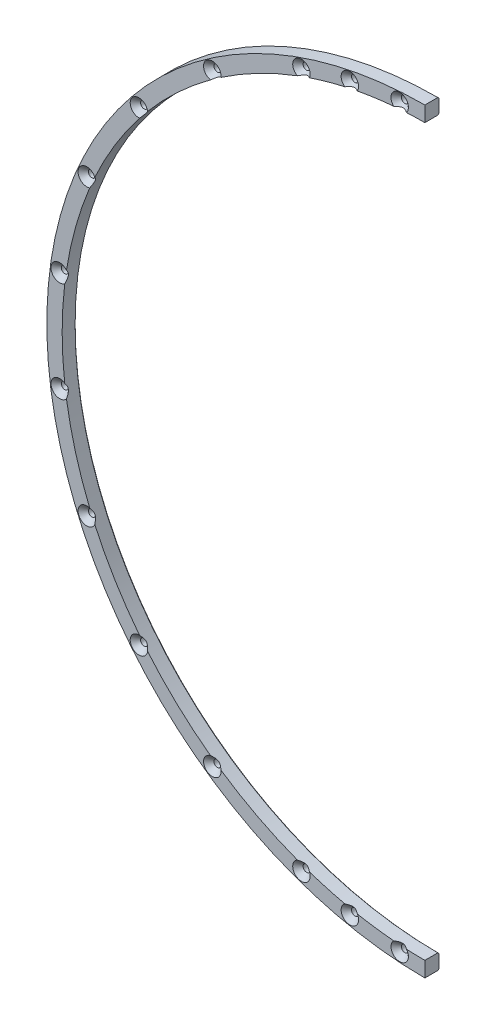
from build123d import *

# Parameters (mm, degrees)
SKETCH1_R           = 1.5
BOSS_EXTRUDE1_DEPTH = 6
CHAMFER2_SIZE       = 0.500000016


with BuildPart() as part:
    # Sketch1 → Boss-Extrude1 (new body)
    with BuildSketch(Plane.XY):
        with BuildLine():
            Line((0, -153.9), (0, -160.4))
            ThreePointArc((0, -160.4), (-160.4, 0), (0, 160.4))
            Line((0, 160.4), (0, 153.9))
            ThreePointArc((0, 153.9), (-153.9, 0), (0, -153.9))
        make_face()
        with Locations((-10.67311345, 156.035395501)):
            Circle(SKETCH1_R, mode=Mode.SUBTRACT)
        with Locations((-31.820520441, 153.128751314)):
            Circle(SKETCH1_R, mode=Mode.SUBTRACT)
        with Locations((-52.375171344, 147.369608219)):
            Circle(SKETCH1_R, mode=Mode.SUBTRACT)
        with Locations((-154.94328196, 21.296463919)):
            Circle(SKETCH1_R, mode=Mode.SUBTRACT)
        with Locations((-143.451847555, 62.309930452)):
            Circle(SKETCH1_R, mode=Mode.SUBTRACT)
        with Locations((-121.321245866, 98.702154493)):
            Circle(SKETCH1_R, mode=Mode.SUBTRACT)
        with Locations((-90.192802379, 127.774091267)):
            Circle(SKETCH1_R, mode=Mode.SUBTRACT)
        with Locations((-154.94328196, -21.296463919)):
            Circle(SKETCH1_R, mode=Mode.SUBTRACT)
        with Locations((-143.451847555, -62.309930452)):
            Circle(SKETCH1_R, mode=Mode.SUBTRACT)
        with Locations((-121.321245866, -98.702154493)):
            Circle(SKETCH1_R, mode=Mode.SUBTRACT)
        with Locations((-90.192802379, -127.774091267)):
            Circle(SKETCH1_R, mode=Mode.SUBTRACT)
        with Locations((-52.375171344, -147.369608219)):
            Circle(SKETCH1_R, mode=Mode.SUBTRACT)
        with Locations((-10.67311345, -156.035395501)):
            Circle(SKETCH1_R, mode=Mode.SUBTRACT)
        with Locations((-31.820520441, -153.128751314)):
            Circle(SKETCH1_R, mode=Mode.SUBTRACT)
    extrude(amount=BOSS_EXTRUDE1_DEPTH)

    # Chamfer1: read off the stored shape, not the designer's step
    # Chamfer1: loft between two sections, ruled curve by curve
    chamfer1_from = [
        Edge.make_three_point_arc((-9.17311345, -156.035395501, 3.8), (-10.67311345, -154.535395501, 3.8), (-12.17311345, -156.035395501, 3.8)),
        Edge.make_three_point_arc((-12.17311345, -156.035395501, 3.8), (-10.67311345, -157.535395501, 3.8), (-9.17311345, -156.035395501, 3.8)),
    ]
    chamfer1_to = [
        Edge.make_three_point_arc((-6.97311345, -156.035395501, 6), (-10.67311345, -152.335395501, 6), (-14.37311345, -156.035395501, 6)),
        Edge.make_three_point_arc((-14.37311345, -156.035395501, 6), (-10.67311345, -159.735395501, 6), (-6.97311345, -156.035395501, 6)),
    ]
    chamfer1 = Solid(Shell([*[Face.make_surface_from_curves(chamfer1_from[k], chamfer1_to[k]) for k in range(2)], Face(Wire(chamfer1_from)), Face(Wire(chamfer1_to))]))
    add(chamfer1, mode=Mode.SUBTRACT)

    # Chamfer1 2: loft between two sections, ruled curve by curve
    chamfer1_2_from = [
        Edge.make_three_point_arc((-30.320520441, -153.128751314, 3.8), (-31.820520441, -151.628751314, 3.8), (-33.320520441, -153.128751314, 3.8)),
        Edge.make_three_point_arc((-33.320520441, -153.128751314, 3.8), (-31.820520441, -154.628751314, 3.8), (-30.320520441, -153.128751314, 3.8)),
    ]
    chamfer1_2_to = [
        Edge.make_three_point_arc((-28.120520441, -153.128751314, 6), (-31.820520441, -149.428751314, 6), (-35.520520441, -153.128751314, 6)),
        Edge.make_three_point_arc((-35.520520441, -153.128751314, 6), (-31.820520441, -156.828751314, 6), (-28.120520441, -153.128751314, 6)),
    ]
    chamfer1_2 = Solid(Shell([*[Face.make_surface_from_curves(chamfer1_2_from[k], chamfer1_2_to[k]) for k in range(2)], Face(Wire(chamfer1_2_from)), Face(Wire(chamfer1_2_to))]))
    add(chamfer1_2, mode=Mode.SUBTRACT)

    # Chamfer1 3: loft between two sections, ruled curve by curve
    chamfer1_3_from = [
        Edge.make_three_point_arc((-50.875171344, -147.369608219, 3.8), (-52.375171344, -145.869608219, 3.8), (-53.875171344, -147.369608219, 3.8)),
        Edge.make_three_point_arc((-53.875171344, -147.369608219, 3.8), (-52.375171344, -148.869608219, 3.8), (-50.875171344, -147.369608219, 3.8)),
    ]
    chamfer1_3_to = [
        Edge.make_three_point_arc((-48.675171344, -147.369608219, 6), (-52.375171344, -143.669608219, 6), (-56.075171344, -147.369608219, 6)),
        Edge.make_three_point_arc((-56.075171344, -147.369608219, 6), (-52.375171344, -151.069608219, 6), (-48.675171344, -147.369608219, 6)),
    ]
    chamfer1_3 = Solid(Shell([*[Face.make_surface_from_curves(chamfer1_3_from[k], chamfer1_3_to[k]) for k in range(2)], Face(Wire(chamfer1_3_from)), Face(Wire(chamfer1_3_to))]))
    add(chamfer1_3, mode=Mode.SUBTRACT)

    # Chamfer1 4: loft between two sections, ruled curve by curve
    chamfer1_4_from = [
        Edge.make_three_point_arc((-88.692802379, -127.774091267, 3.8), (-90.192802379, -126.274091267, 3.8), (-91.692802379, -127.774091267, 3.8)),
        Edge.make_three_point_arc((-91.692802379, -127.774091267, 3.8), (-90.192802379, -129.274091267, 3.8), (-88.692802379, -127.774091267, 3.8)),
    ]
    chamfer1_4_to = [
        Edge.make_three_point_arc((-86.492802379, -127.774091267, 6), (-90.192802379, -124.074091267, 6), (-93.892802379, -127.774091267, 6)),
        Edge.make_three_point_arc((-93.892802379, -127.774091267, 6), (-90.192802379, -131.474091267, 6), (-86.492802379, -127.774091267, 6)),
    ]
    chamfer1_4 = Solid(Shell([*[Face.make_surface_from_curves(chamfer1_4_from[k], chamfer1_4_to[k]) for k in range(2)], Face(Wire(chamfer1_4_from)), Face(Wire(chamfer1_4_to))]))
    add(chamfer1_4, mode=Mode.SUBTRACT)

    # Chamfer1 5: loft between two sections, ruled curve by curve
    chamfer1_5_from = [
        Edge.make_three_point_arc((-119.821245866, -98.702154493, 3.8), (-121.321245866, -97.202154493, 3.8), (-122.821245866, -98.702154493, 3.8)),
        Edge.make_three_point_arc((-122.821245866, -98.702154493, 3.8), (-121.321245866, -100.202154493, 3.8), (-119.821245866, -98.702154493, 3.8)),
    ]
    chamfer1_5_to = [
        Edge.make_three_point_arc((-117.621245866, -98.702154493, 6), (-121.321245866, -95.002154493, 6), (-125.021245866, -98.702154493, 6)),
        Edge.make_three_point_arc((-125.021245866, -98.702154493, 6), (-121.321245866, -102.402154493, 6), (-117.621245866, -98.702154493, 6)),
    ]
    chamfer1_5 = Solid(Shell([*[Face.make_surface_from_curves(chamfer1_5_from[k], chamfer1_5_to[k]) for k in range(2)], Face(Wire(chamfer1_5_from)), Face(Wire(chamfer1_5_to))]))
    add(chamfer1_5, mode=Mode.SUBTRACT)

    # Chamfer1 6: loft between two sections, ruled curve by curve
    chamfer1_6_from = [
        Edge.make_three_point_arc((-141.951847555, -62.309930452, 3.8), (-143.451847555, -60.809930452, 3.8), (-144.951847555, -62.309930452, 3.8)),
        Edge.make_three_point_arc((-144.951847555, -62.309930452, 3.8), (-143.451847555, -63.809930452, 3.8), (-141.951847555, -62.309930452, 3.8)),
    ]
    chamfer1_6_to = [
        Edge.make_three_point_arc((-139.751847555, -62.309930452, 6), (-143.451847555, -58.609930452, 6), (-147.151847555, -62.309930452, 6)),
        Edge.make_three_point_arc((-147.151847555, -62.309930452, 6), (-143.451847555, -66.009930452, 6), (-139.751847555, -62.309930452, 6)),
    ]
    chamfer1_6 = Solid(Shell([*[Face.make_surface_from_curves(chamfer1_6_from[k], chamfer1_6_to[k]) for k in range(2)], Face(Wire(chamfer1_6_from)), Face(Wire(chamfer1_6_to))]))
    add(chamfer1_6, mode=Mode.SUBTRACT)

    # Chamfer1 7: loft between two sections, ruled curve by curve
    chamfer1_7_from = [
        Edge.make_three_point_arc((-153.44328196, -21.296463919, 3.8), (-154.94328196, -19.796463919, 3.8), (-156.44328196, -21.296463919, 3.8)),
        Edge.make_three_point_arc((-156.44328196, -21.296463919, 3.8), (-154.94328196, -22.796463919, 3.8), (-153.44328196, -21.296463919, 3.8)),
    ]
    chamfer1_7_to = [
        Edge.make_three_point_arc((-151.24328196, -21.296463919, 6), (-154.94328196, -17.596463919, 6), (-158.64328196, -21.296463919, 6)),
        Edge.make_three_point_arc((-158.64328196, -21.296463919, 6), (-154.94328196, -24.996463919, 6), (-151.24328196, -21.296463919, 6)),
    ]
    chamfer1_7 = Solid(Shell([*[Face.make_surface_from_curves(chamfer1_7_from[k], chamfer1_7_to[k]) for k in range(2)], Face(Wire(chamfer1_7_from)), Face(Wire(chamfer1_7_to))]))
    add(chamfer1_7, mode=Mode.SUBTRACT)

    # Chamfer1 8: loft between two sections, ruled curve by curve
    chamfer1_8_from = [
        Edge.make_three_point_arc((-153.44328196, 21.296463919, 3.8), (-154.94328196, 22.796463919, 3.8), (-156.44328196, 21.296463919, 3.8)),
        Edge.make_three_point_arc((-156.44328196, 21.296463919, 3.8), (-154.94328196, 19.796463919, 3.8), (-153.44328196, 21.296463919, 3.8)),
    ]
    chamfer1_8_to = [
        Edge.make_three_point_arc((-151.24328196, 21.296463919, 6), (-154.94328196, 24.996463919, 6), (-158.64328196, 21.296463919, 6)),
        Edge.make_three_point_arc((-158.64328196, 21.296463919, 6), (-154.94328196, 17.596463919, 6), (-151.24328196, 21.296463919, 6)),
    ]
    chamfer1_8 = Solid(Shell([*[Face.make_surface_from_curves(chamfer1_8_from[k], chamfer1_8_to[k]) for k in range(2)], Face(Wire(chamfer1_8_from)), Face(Wire(chamfer1_8_to))]))
    add(chamfer1_8, mode=Mode.SUBTRACT)

    # Chamfer1 9: loft between two sections, ruled curve by curve
    chamfer1_9_from = [
        Edge.make_three_point_arc((-141.951847555, 62.309930452, 3.8), (-143.451847555, 63.809930452, 3.8), (-144.951847555, 62.309930452, 3.8)),
        Edge.make_three_point_arc((-144.951847555, 62.309930452, 3.8), (-143.451847555, 60.809930452, 3.8), (-141.951847555, 62.309930452, 3.8)),
    ]
    chamfer1_9_to = [
        Edge.make_three_point_arc((-139.751847555, 62.309930452, 6), (-143.451847555, 66.009930452, 6), (-147.151847555, 62.309930452, 6)),
        Edge.make_three_point_arc((-147.151847555, 62.309930452, 6), (-143.451847555, 58.609930452, 6), (-139.751847555, 62.309930452, 6)),
    ]
    chamfer1_9 = Solid(Shell([*[Face.make_surface_from_curves(chamfer1_9_from[k], chamfer1_9_to[k]) for k in range(2)], Face(Wire(chamfer1_9_from)), Face(Wire(chamfer1_9_to))]))
    add(chamfer1_9, mode=Mode.SUBTRACT)

    # Chamfer1 10: loft between two sections, ruled curve by curve
    chamfer1_10_from = [
        Edge.make_three_point_arc((-119.821245866, 98.702154493, 3.8), (-121.321245866, 100.202154493, 3.8), (-122.821245866, 98.702154493, 3.8)),
        Edge.make_three_point_arc((-122.821245866, 98.702154493, 3.8), (-121.321245866, 97.202154493, 3.8), (-119.821245866, 98.702154493, 3.8)),
    ]
    chamfer1_10_to = [
        Edge.make_three_point_arc((-117.621245866, 98.702154493, 6), (-121.321245866, 102.402154493, 6), (-125.021245866, 98.702154493, 6)),
        Edge.make_three_point_arc((-125.021245866, 98.702154493, 6), (-121.321245866, 95.002154493, 6), (-117.621245866, 98.702154493, 6)),
    ]
    chamfer1_10 = Solid(Shell([*[Face.make_surface_from_curves(chamfer1_10_from[k], chamfer1_10_to[k]) for k in range(2)], Face(Wire(chamfer1_10_from)), Face(Wire(chamfer1_10_to))]))
    add(chamfer1_10, mode=Mode.SUBTRACT)

    # Chamfer1 11: loft between two sections, ruled curve by curve
    chamfer1_11_from = [
        Edge.make_three_point_arc((-88.692802379, 127.774091267, 3.8), (-90.192802379, 129.274091267, 3.8), (-91.692802379, 127.774091267, 3.8)),
        Edge.make_three_point_arc((-91.692802379, 127.774091267, 3.8), (-90.192802379, 126.274091267, 3.8), (-88.692802379, 127.774091267, 3.8)),
    ]
    chamfer1_11_to = [
        Edge.make_three_point_arc((-86.492802379, 127.774091267, 6), (-90.192802379, 131.474091267, 6), (-93.892802379, 127.774091267, 6)),
        Edge.make_three_point_arc((-93.892802379, 127.774091267, 6), (-90.192802379, 124.074091267, 6), (-86.492802379, 127.774091267, 6)),
    ]
    chamfer1_11 = Solid(Shell([*[Face.make_surface_from_curves(chamfer1_11_from[k], chamfer1_11_to[k]) for k in range(2)], Face(Wire(chamfer1_11_from)), Face(Wire(chamfer1_11_to))]))
    add(chamfer1_11, mode=Mode.SUBTRACT)

    # Chamfer1 12: loft between two sections, ruled curve by curve
    chamfer1_12_from = [
        Edge.make_three_point_arc((-50.875171344, 147.369608219, 3.8), (-52.375171344, 148.869608219, 3.8), (-53.875171344, 147.369608219, 3.8)),
        Edge.make_three_point_arc((-53.875171344, 147.369608219, 3.8), (-52.375171344, 145.869608219, 3.8), (-50.875171344, 147.369608219, 3.8)),
    ]
    chamfer1_12_to = [
        Edge.make_three_point_arc((-48.675171344, 147.369608219, 6), (-52.375171344, 151.069608219, 6), (-56.075171344, 147.369608219, 6)),
        Edge.make_three_point_arc((-56.075171344, 147.369608219, 6), (-52.375171344, 143.669608219, 6), (-48.675171344, 147.369608219, 6)),
    ]
    chamfer1_12 = Solid(Shell([*[Face.make_surface_from_curves(chamfer1_12_from[k], chamfer1_12_to[k]) for k in range(2)], Face(Wire(chamfer1_12_from)), Face(Wire(chamfer1_12_to))]))
    add(chamfer1_12, mode=Mode.SUBTRACT)

    # Chamfer1 13: loft between two sections, ruled curve by curve
    chamfer1_13_from = [
        Edge.make_three_point_arc((-30.320520441, 153.128751314, 3.8), (-31.820520441, 154.628751314, 3.8), (-33.320520441, 153.128751314, 3.8)),
        Edge.make_three_point_arc((-33.320520441, 153.128751314, 3.8), (-31.820520441, 151.628751314, 3.8), (-30.320520441, 153.128751314, 3.8)),
    ]
    chamfer1_13_to = [
        Edge.make_three_point_arc((-28.120520441, 153.128751314, 6), (-31.820520441, 156.828751314, 6), (-35.520520441, 153.128751314, 6)),
        Edge.make_three_point_arc((-35.520520441, 153.128751314, 6), (-31.820520441, 149.428751314, 6), (-28.120520441, 153.128751314, 6)),
    ]
    chamfer1_13 = Solid(Shell([*[Face.make_surface_from_curves(chamfer1_13_from[k], chamfer1_13_to[k]) for k in range(2)], Face(Wire(chamfer1_13_from)), Face(Wire(chamfer1_13_to))]))
    add(chamfer1_13, mode=Mode.SUBTRACT)

    # Chamfer1 14: loft between two sections, ruled curve by curve
    chamfer1_14_from = [
        Edge.make_three_point_arc((-9.17311345, 156.035395501, 3.8), (-10.67311345, 157.535395501, 3.8), (-12.17311345, 156.035395501, 3.8)),
        Edge.make_three_point_arc((-12.17311345, 156.035395501, 3.8), (-10.67311345, 154.535395501, 3.8), (-9.17311345, 156.035395501, 3.8)),
    ]
    chamfer1_14_to = [
        Edge.make_three_point_arc((-6.97311345, 156.035395501, 6), (-10.67311345, 159.735395501, 6), (-14.37311345, 156.035395501, 6)),
        Edge.make_three_point_arc((-14.37311345, 156.035395501, 6), (-10.67311345, 152.335395501, 6), (-6.97311345, 156.035395501, 6)),
    ]
    chamfer1_14 = Solid(Shell([*[Face.make_surface_from_curves(chamfer1_14_from[k], chamfer1_14_to[k]) for k in range(2)], Face(Wire(chamfer1_14_from)), Face(Wire(chamfer1_14_to))]))
    add(chamfer1_14, mode=Mode.SUBTRACT)

    # Chamfer2
    chamfer2_edges = [part.edges().sort_by_distance(p)[0] for p in [
        (-153.9, 0, 0),
        (-160.4, 0, 0),
    ]]
    chamfer(chamfer2_edges, length=CHAMFER2_SIZE)


solid = part.part
